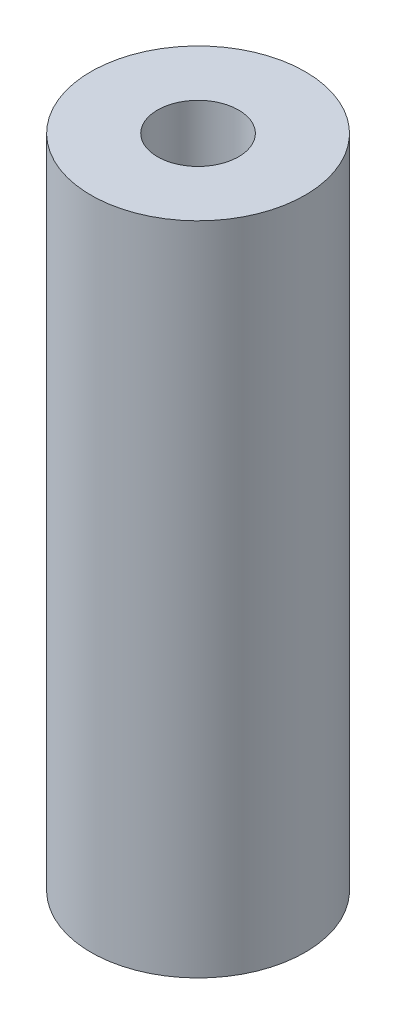
from build123d import *

# Parameters (mm, degrees)
SKETCH1_R           = 3.1115
SKETCH1_R_2         = 1.178075392
BOSS_EXTRUDE1_DEPTH = 19.05


with BuildPart() as part:
    # Sketch1 → Boss-Extrude1 (new body)
    with BuildSketch(Plane(origin=(0, 0, 0), x_dir=(1, 0, 0), z_dir=(0, 1, 0))):
        Circle(SKETCH1_R)
        Circle(SKETCH1_R_2, mode=Mode.SUBTRACT)
    extrude(amount=BOSS_EXTRUDE1_DEPTH)


solid = part.part
